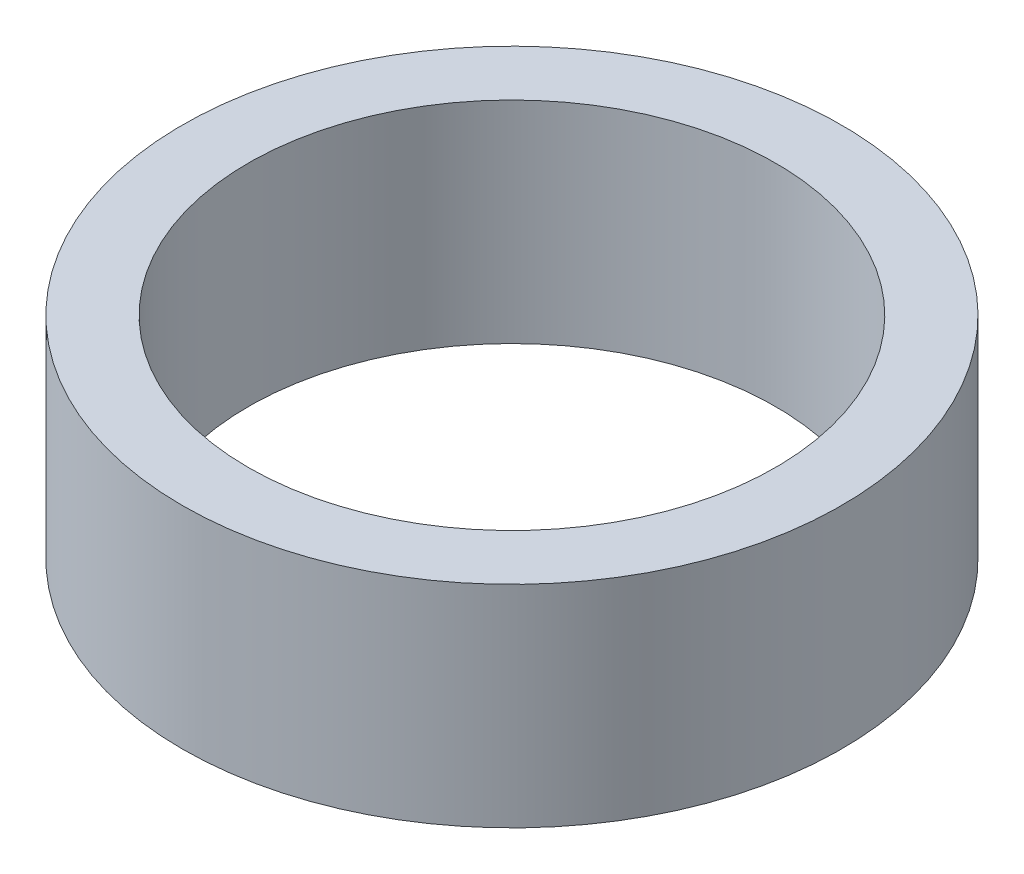
from build123d import *

# Parameters (mm, degrees)
SKETCH1_R           = 37.5
BOSS_EXTRUDE1_DEPTH = 24
SKETCH2_R           = 30
CUT_EXTRUDE1_DEPTH  = 59.210823736


with BuildPart() as part:
    # Sketch1 → Boss-Extrude1 (new body)
    with BuildSketch(Plane(origin=(0, 0, 0), x_dir=(1, 0, 0), z_dir=(0, 1, 0))):
        Circle(SKETCH1_R)
    extrude(amount=BOSS_EXTRUDE1_DEPTH)

    # Sketch2 → Cut-Extrude1 (cut, through all)
    with BuildSketch(Plane(origin=(0, 0, 0), x_dir=(1, 0, 0), z_dir=(0, 1, 0))):
        Circle(SKETCH2_R)
    extrude(amount=CUT_EXTRUDE1_DEPTH, mode=Mode.SUBTRACT)


solid = part.part
